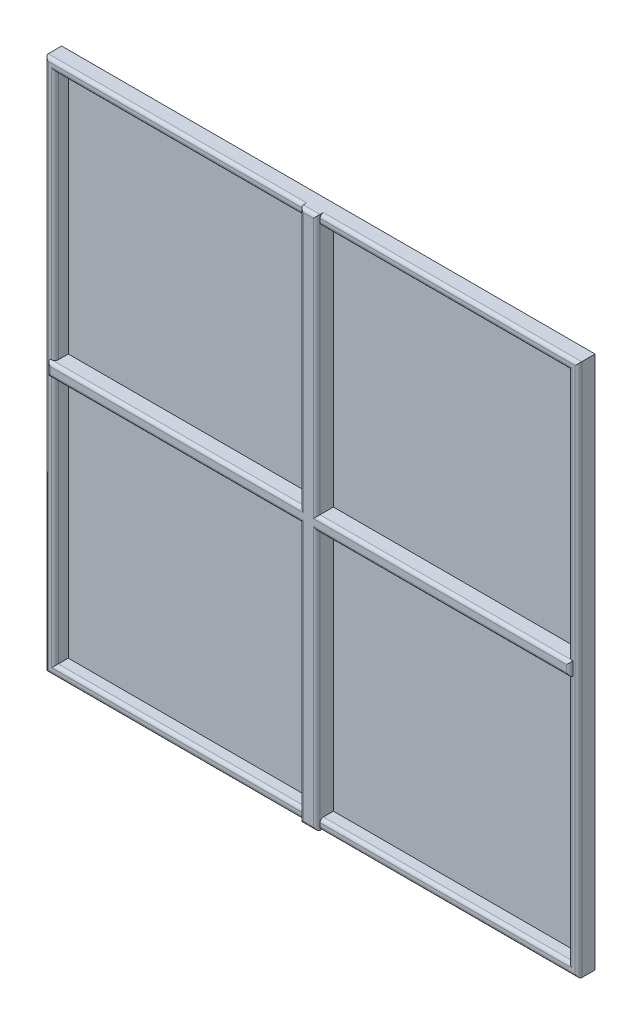
from build123d import *

# Parameters (mm, degrees)
SKETCH1_W           = 1600
SKETCH1_H           = 1600
SKETCH1_W_2         = 1540
SKETCH1_H_2         = 1540
BOSS_EXTRUDE1_DEPTH = 50
FILLET1_R           = 10
SKETCH2_W           = 50
SKETCH2_H           = 1600
SKETCH2_W_2         = 1568
SKETCH2_H_2         = 40
BOSS_EXTRUDE2_DEPTH = 60
FILLET2_R           = 10
SKETCH4_W           = 1560
SKETCH4_H           = 1560
BOSS_EXTRUDE3_DEPTH = 10
SCALE1_SCALE        = 0.25
SCALE2_SCALE        = 0.32


with BuildPart() as part:
    # Sketch1 → Boss-Extrude1 (new body)
    with BuildSketch(Plane.XY):
        with Locations((-800, 800)):
            Rectangle(SKETCH1_W, SKETCH1_H)
        with Locations((-800, 800)):
            Rectangle(SKETCH1_W_2, SKETCH1_H_2, mode=Mode.SUBTRACT)
    extrude(amount=BOSS_EXTRUDE1_DEPTH)

    # Fillet1
    fillet1_edges = [part.edges().sort_by_distance(p)[0] for p in [
        (-1600, 800, 50),
        (-800, 0, 50),
        (-800, 30, 50),
        (-30, 800, 50),
        (-800, 1570, 50),
        (-1570, 800, 50),
        (0, 800, 50),
        (-800, 1600, 50),
    ]]
    fillet(fillet1_edges, radius=FILLET1_R)

    # Sketch2 → Boss-Extrude2 (add)
    with BuildSketch(Plane.XY):
        with Locations((-800, 800)):
            Rectangle(SKETCH2_W, SKETCH2_H)
        with Locations((-800, 800)):
            Rectangle(SKETCH2_W_2, SKETCH2_H_2)
    extrude(amount=BOSS_EXTRUDE2_DEPTH)

    # Fillet2
    fillet2_edges = [part.edges().sort_by_distance(p)[0] for p in [
        (-800, 0, 60),
        (-825, 390, 60),
        (-1204.5, 780, 60),
        (-1584, 800, 60),
        (-1204.5, 820, 60),
        (-825, 1210, 60),
        (-800, 1600, 60),
        (-775, 1210, 60),
        (-395.5, 820, 60),
        (-16, 800, 60),
        (-395.5, 780, 60),
        (-775, 390, 60),
    ]]
    fillet(fillet2_edges, radius=FILLET2_R - 0.0001)  # a hair under: the kernel refuses the full size


with BuildPart() as body_2:
    # Sketch4 → Boss-Extrude3 (new body)
    with BuildSketch(Plane.XY):
        with Locations((-800, 800)):
            Rectangle(SKETCH4_W, SKETCH4_H)
    extrude(amount=BOSS_EXTRUDE3_DEPTH)


with BuildPart() as body_2_1:
    # Scale1: scaled about (0, 0, 0)
    add(body_2.part.scale(SCALE1_SCALE))


with BuildPart() as part_1:
    # Scale1: scaled about (0, 0, 0)
    add(part.part.scale(SCALE1_SCALE))


with BuildPart() as part_2:
    # Scale2: scaled about (0, 0, 0)
    add(part_1.part.scale(SCALE2_SCALE))


with BuildPart() as body_2_2:
    # Scale2: scaled about (0, 0, 0)
    add(body_2_1.part.scale(SCALE2_SCALE))


solid = Compound([part_2.part, body_2_2.part])
